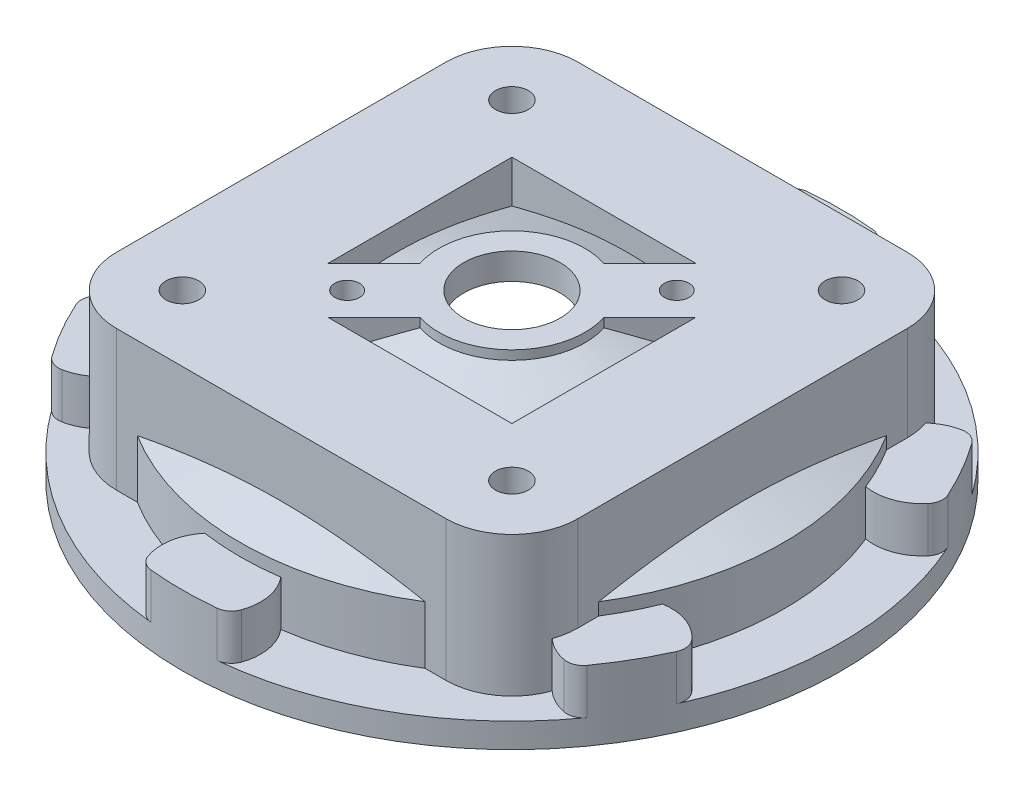
from build123d import *
from build123d.topology import SkipClean

# Parameters (mm, degrees)
SKETCH1_R                 = 40
SKETCH1_R_2               = 30
BOSS_EXTRUDE1_DEPTH       = 3
SKETCH2_R                 = 33
SKETCH2_R_2               = 30
BOSS_EXTRUDE2_DEPTH       = 7
BOSS_EXTRUDE3_REACH       = 62
SKETCH4_R                 = 5.848303283
BOSS_EXTRUDE5_DEPTH       = 17
F_4_0MM_DOWEL_HOLE2_D     = 4
F_4_0MM_DOWEL_HOLE3_D     = 4
F_4_0MM_DOWEL_HOLE3_DEPTH = 6.5
F_4_0MM_DOWEL_HOLE3_TIP   = 1.201721238
F_3_0MM_DOWEL_HOLE2_D     = 3
F_3_0MM_DOWEL_HOLE2_DEPTH = 4.2
F_3_0MM_DOWEL_HOLE2_TIP   = 0.901290929
SKETCH22_R                = 2
BOSS_EXTRUDE7_DEPTH       = 3.5
BOSS_EXTRUDE8_DEPTH       = 2
FILLET1_R                 = 2


with BuildPart() as part:
    # Sketch1 → Boss-Extrude1 (new body)
    with BuildSketch(Plane(origin=(0, 0, 0), x_dir=(1, 0, 0), z_dir=(0, 1, 0))):
        with Locations(Location((0, 0, 0), (0, 0, 270))):
            Circle(SKETCH1_R)
        with Locations(Location((0, 0, 0), (0, 0, 270))):
            Circle(SKETCH1_R_2, mode=Mode.SUBTRACT)
    extrude(amount=BOSS_EXTRUDE1_DEPTH)

    # Sketch2 → Boss-Extrude2 (add)
    with BuildSketch(Plane(origin=(0, 3, 0), x_dir=(1, 0, 0), z_dir=(0, 1, 0))):
        with Locations(Location((0, 0, 0), (0, 0, 270))):
            Circle(SKETCH2_R)
        with Locations(Location((0, 0, 0), (0, 0, 270))):
            Circle(SKETCH2_R_2, mode=Mode.SUBTRACT)
    extrude(amount=BOSS_EXTRUDE2_DEPTH)

    # Sketch3 → Revolve1 (revolve)
    with BuildSketch(Plane.XY, mode=Mode.PRIVATE) as revolve1_sk:
        Polygon((-33, 10), (-5.848303283, 20), (-5.848303283, 16.802999631), (-31.963181234, 7.184861132), align=None)
    revolve(revolve1_sk.sketch.rotate(Axis((0, 0, 0), (0, 1, 0)), 270), axis=Axis((0, 0, 0), (0, 1, 0)))

    # Boss-Extrude3: up to this cone (the profile starts outside it)
    boss_extrude3_end = Plane(origin=(0, 20, 0), z_dir=(0, -1, 0)).offset(-2.153935582) * Cone(2.715e-06, 191.425543469, 70.502238865, align=(Align.CENTER, Align.CENTER, Align.MIN), mode=Mode.PRIVATE)
    # Sketch4 → Boss-Extrude3 (add, up to the surface)
    with BuildSketch(Plane(origin=(0, 20, 0), x_dir=(1, 0, 0), z_dir=(0, 1, 0)), mode=Mode.PRIVATE) as boss_extrude3_sk1:
        with BuildLine():
            Line((-28, -20), (-28, 20))
            ThreePointArc((-28, 20), (-25.656854249, 25.656854249), (-20, 28))
            Line((-20, 28), (20, 28))
            ThreePointArc((20, 28), (25.656854249, 25.656854249), (28, 20))
            Line((28, 20), (28, -20))
            ThreePointArc((28, -20), (25.656854249, -25.656854249), (20, -28))
            Line((20, -28), (-20, -28))
            ThreePointArc((-20, -28), (-25.656854249, -25.656854249), (-28, -20))
        make_face()
        with Locations(Location((0, 0, 0), (0, 0, 90))):
            Circle(SKETCH4_R, mode=Mode.SUBTRACT)
        with BuildLine():
            Line((-14, -8.343145751), (-8.409308372, -2.752454122))
            ThreePointArc((-8.409308372, -2.752454122), (-6.256695253, 6.256695253), (2.752454122, 8.409308372))
            Line((2.752454122, 8.409308372), (8.343145751, 14))
            Line((8.343145751, 14), (-14, 14))
            Line((-14, 14), (-14, -8.343145751))
        make_face(mode=Mode.SUBTRACT)
        with BuildLine():
            Line((14, -14), (-8.343145751, -14))
            Line((-8.343145751, -14), (-2.752454122, -8.409308372))
            ThreePointArc((-2.752454122, -8.409308372), (6.256695253, -6.256695253), (8.409308372, 2.752454122))
            Line((8.409308372, 2.752454122), (14, 8.343145751))
            Line((14, 8.343145751), (14, -14))
        make_face(mode=Mode.SUBTRACT)
    boss_extrude3_tool1 = extrude(boss_extrude3_sk1.sketch, amount=-BOSS_EXTRUDE3_REACH, mode=Mode.PRIVATE) - boss_extrude3_end
    add(boss_extrude3_tool1.solids().sort_by_distance((-25.096854, 20, 25.096854))[0])

    # Sketch6 → Boss-Extrude5 (add)
    with BuildSketch(Plane(origin=(0, 20, 0), x_dir=(1, 0, 0), z_dir=(0, 1, 0))):
        with BuildLine():
            Line((-20, -28), (-17.464249197, -28))
            ThreePointArc((-17.464249197, -28), (-23.334523779, -23.334523779), (-28, -17.464249197))
            Line((-28, -17.464249197), (-28, -20))
            ThreePointArc((-28, -20), (-25.656854249, -25.656854249), (-20, -28))
        make_face()
        with BuildLine():
            Line((28, -20), (28, -17.464249197))
            ThreePointArc((28, -17.464249197), (23.334523779, -23.334523779), (17.464249197, -28))
            Line((17.464249197, -28), (20, -28))
            ThreePointArc((20, -28), (25.656854249, -25.656854249), (28, -20))
        make_face()
        with BuildLine():
            Line((20, 28), (17.464249197, 28))
            ThreePointArc((17.464249197, 28), (23.334523779, 23.334523779), (28, 17.464249197))
            Line((28, 17.464249197), (28, 20))
            ThreePointArc((28, 20), (25.656854249, 25.656854249), (20, 28))
        make_face()
        with BuildLine():
            Line((-28, 20), (-28, 17.464249197))
            ThreePointArc((-28, 17.464249197), (-23.334523779, 23.334523779), (-17.464249197, 28))
            Line((-17.464249197, 28), (-20, 28))
            ThreePointArc((-20, 28), (-25.656854249, 25.656854249), (-28, 20))
        make_face()
    extrude(amount=-BOSS_EXTRUDE5_DEPTH)

    # Ø4.0mm Dowel Hole2 (through all)
    with Locations(Plane(origin=(0, 3, 0), x_dir=(1, 0, 0), z_dir=(0, 1, 0))):
        with Locations((0, 36.5), (31.609927238, 18.25), (31.609927238, -18.25), (0, -36.5), (-31.609927238, -18.25), (-31.609927238, 18.25)):
            Hole(F_4_0MM_DOWEL_HOLE2_D / 2)

    # Ø4.0mm Dowel Hole3
    with Locations(Plane(origin=(0, 20, 0), x_dir=(1, 0, 0), z_dir=(0, 1, 0))):
        with Locations((-20, 20), (20, 20), (20, -20), (-20, -20)):
            Hole(F_4_0MM_DOWEL_HOLE3_D / 2, depth=F_4_0MM_DOWEL_HOLE3_DEPTH)
            with Locations((0, 0, -(F_4_0MM_DOWEL_HOLE3_DEPTH + F_4_0MM_DOWEL_HOLE3_TIP / 2))):  # 118° drill point
                Cone(0, F_4_0MM_DOWEL_HOLE3_D / 2, F_4_0MM_DOWEL_HOLE3_TIP, mode=Mode.SUBTRACT)

    # Ø3.0mm Dowel Hole2
    with Locations(Plane(origin=(0, 20, 0), x_dir=(1, 0, 0), z_dir=(0, 1, 0))):
        with Locations((10, 10), (-10, -10)):
            Hole(F_3_0MM_DOWEL_HOLE2_D / 2, depth=F_3_0MM_DOWEL_HOLE2_DEPTH)
            with Locations((0, 0, -(F_3_0MM_DOWEL_HOLE2_DEPTH + F_3_0MM_DOWEL_HOLE2_TIP / 2))):  # 118° drill point
                Cone(0, F_3_0MM_DOWEL_HOLE2_D / 2, F_3_0MM_DOWEL_HOLE2_TIP, mode=Mode.SUBTRACT)

    # Sketch22 → Boss-Extrude7 (add)
    # profile 1 of 6: a face of its own
    with SkipClean():  # the faces are left unmerged after this step: merging them gives an invalid solid
        with BuildSketch(Plane(origin=(0, 3, 0), x_dir=(1, 0, 0), z_dir=(0, 1, 0))):
            with BuildLine():
                ThreePointArc((-36.904921812, -15.428115441), (-34.641016151, -20), (-31.81360081, -24.246542093))
                ThreePointArc((-31.81360081, -24.246542093), (-28.269344004, -23.234024845), (-25.985874114, -20.340460824))
                ThreePointArc((-25.985874114, -20.340460824), (-28.578838325, -16.5), (-30.608292855, -12.33419671))
                ThreePointArc((-30.608292855, -12.33419671), (-34.25592775, -12.864957633), (-36.904921812, -15.428115441))
            make_face()
            with Locations(Location((-31.609927238, -18.25, 0), (0, 0, 270))):
                Circle(SKETCH22_R, mode=Mode.SUBTRACT)
        # profile 2 of 6: a face of its own
        with BuildSketch(Plane(origin=(0, 3, 0), x_dir=(1, 0, 0), z_dir=(0, 1, 0))):
            with BuildLine():
                ThreePointArc((36.904921812, 15.428115441), (34.641016151, 20), (31.81360081, 24.246542093))
                ThreePointArc((31.81360081, 24.246542093), (28.269344004, 23.234024845), (25.985874114, 20.340460824))
                ThreePointArc((25.985874114, 20.340460824), (28.578838325, 16.5), (30.608292855, 12.33419671))
                ThreePointArc((30.608292855, 12.33419671), (34.25592775, 12.864957633), (36.904921812, 15.428115441))
            make_face()
            with Locations(Location((31.609927238, 18.25, 0), (0, 0, 270))):
                Circle(SKETCH22_R, mode=Mode.SUBTRACT)
        # profile 3 of 6: a face of its own
        with BuildSketch(Plane(origin=(0, 3, 0), x_dir=(1, 0, 0), z_dir=(0, 1, 0))):
            with BuildLine():
                ThreePointArc((25.985874114, -20.340460824), (28.578838325, -16.5), (30.608292855, -12.33419671))
                ThreePointArc((30.608292855, -12.33419671), (34.25592775, -12.864957633), (36.904921812, -15.428115441))
                ThreePointArc((36.904921812, -15.428115441), (34.641016151, -20), (31.81360081, -24.246542093))
                ThreePointArc((31.81360081, -24.246542093), (28.269344004, -23.234024845), (25.985874114, -20.340460824))
            make_face()
            with Locations(Location((31.609927238, -18.25, 0), (0, 0, 270))):
                Circle(SKETCH22_R, mode=Mode.SUBTRACT)
        # profile 4 of 6: a face of its own
        with BuildSketch(Plane(origin=(0, 3, 0), x_dir=(1, 0, 0), z_dir=(0, 1, 0))):
            with BuildLine():
                ThreePointArc((-4.622418741, -32.674657534), (0, -33), (4.622418741, -32.674657534))
                ThreePointArc((4.622418741, -32.674657534), (5.986583746, -36.098982479), (5.091321001, -39.674657534))
                ThreePointArc((5.091321001, -39.674657534), (0, -40), (-5.091321001, -39.674657534))
                ThreePointArc((-5.091321001, -39.674657534), (-5.986583746, -36.098982479), (-4.622418741, -32.674657534))
            make_face()
            with Locations(Location((0, -36.5, 0), (0, 0, 270))):
                Circle(SKETCH22_R, mode=Mode.SUBTRACT)
        # profile 5 of 6: a face of its own
        with BuildSketch(Plane(origin=(0, 3, 0), x_dir=(1, 0, 0), z_dir=(0, 1, 0))):
            with BuildLine():
                ThreePointArc((-36.904921812, 15.428115441), (-34.25592775, 12.864957633), (-30.608292855, 12.33419671))
                ThreePointArc((-30.608292855, 12.33419671), (-28.578838325, 16.5), (-25.985874114, 20.340460824))
                ThreePointArc((-25.985874114, 20.340460824), (-28.269344004, 23.234024845), (-31.81360081, 24.246542093))
                ThreePointArc((-31.81360081, 24.246542093), (-34.641016151, 20), (-36.904921812, 15.428115441))
            make_face()
            with Locations(Location((-31.609927238, 18.25, 0), (0, 0, 270))):
                Circle(SKETCH22_R, mode=Mode.SUBTRACT)
        # profile 6 of 6: a face of its own
        with BuildSketch(Plane(origin=(0, 3, 0), x_dir=(1, 0, 0), z_dir=(0, 1, 0))):
            with BuildLine():
                ThreePointArc((4.622418741, 32.674657534), (5.986583746, 36.098982479), (5.091321001, 39.674657534))
                ThreePointArc((5.091321001, 39.674657534), (0, 40), (-5.091321001, 39.674657534))
                ThreePointArc((-5.091321001, 39.674657534), (-5.986583746, 36.098982479), (-4.622418741, 32.674657534))
                ThreePointArc((-4.622418741, 32.674657534), (0, 33), (4.622418741, 32.674657534))
            make_face()
            with Locations(Location((0, 36.5, 0), (0, 0, 270))):
                Circle(SKETCH22_R, mode=Mode.SUBTRACT)
        extrude(amount=BOSS_EXTRUDE7_DEPTH)

    # Sketch23 → Boss-Extrude8 (add)
    with SkipClean():  # the faces are left unmerged after this step: merging them gives an invalid solid
        with BuildSketch(Plane(origin=(0, 6.5, 0), x_dir=(1, 0, 0), z_dir=(0, 1, 0))):
            with BuildLine():
                Line((-28, -20), (-28, -17.464249197))
                ThreePointArc((-28, -17.464249197), (-29.416192097, -14.956190776), (-30.608292855, -12.33419671))
                ThreePointArc((-30.608292855, -12.33419671), (-34.25592775, -12.864957633), (-36.904921812, -15.428115441))
                ThreePointArc((-36.904921812, -15.428115441), (-34.641016151, -20), (-31.81360081, -24.246542093))
                ThreePointArc((-31.81360081, -24.246542093), (-29.52266146, -23.87523969), (-27.544015834, -22.662296959))
                ThreePointArc((-27.544015834, -22.662296959), (-27.885179981, -21.350531993), (-28, -20))
            make_face()
            with BuildLine():
                Line((28, -17.464249197), (28, -20))
                ThreePointArc((28, -20), (27.885179981, -21.350531993), (27.544015834, -22.662296959))
                ThreePointArc((27.544015834, -22.662296959), (29.52266146, -23.87523969), (31.81360081, -24.246542093))
                ThreePointArc((31.81360081, -24.246542093), (34.641016151, -20), (36.904921812, -15.428115441))
                ThreePointArc((36.904921812, -15.428115441), (34.25592775, -12.864957633), (30.608292855, -12.33419671))
                ThreePointArc((30.608292855, -12.33419671), (29.416192097, -14.956190776), (28, -17.464249197))
            make_face()
            with BuildLine():
                Line((28, 20), (28, 17.464249197))
                ThreePointArc((28, 17.464249197), (29.416192097, 14.956190776), (30.608292855, 12.33419671))
                ThreePointArc((30.608292855, 12.33419671), (34.25592775, 12.864957633), (36.904921812, 15.428115441))
                ThreePointArc((36.904921812, 15.428115441), (34.641016151, 20), (31.81360081, 24.246542093))
                ThreePointArc((31.81360081, 24.246542093), (29.52266146, 23.87523969), (27.544015834, 22.662296959))
                ThreePointArc((27.544015834, 22.662296959), (27.885179981, 21.350531993), (28, 20))
            make_face()
            with BuildLine():
                Line((-28, 17.464249197), (-28, 20))
                ThreePointArc((-28, 20), (-27.885179981, 21.350531993), (-27.544015834, 22.662296959))
                ThreePointArc((-27.544015834, 22.662296959), (-29.52266146, 23.87523969), (-31.81360081, 24.246542093))
                ThreePointArc((-31.81360081, 24.246542093), (-34.641016151, 20), (-36.904921812, 15.428115441))
                ThreePointArc((-36.904921812, 15.428115441), (-34.25592775, 12.864957633), (-30.608292855, 12.33419671))
                ThreePointArc((-30.608292855, 12.33419671), (-29.416192097, 14.956190776), (-28, 17.464249197))
            make_face()
            with BuildLine():
                ThreePointArc((5.091321001, -39.674657534), (5.986583746, -36.098982479), (4.622418741, -32.674657534))
                ThreePointArc((4.622418741, -32.674657534), (0, -33), (-4.622418741, -32.674657534))
                ThreePointArc((-4.622418741, -32.674657534), (-5.986583746, -36.098982479), (-5.091321001, -39.674657534))
                ThreePointArc((-5.091321001, -39.674657534), (0, -40), (5.091321001, -39.674657534))
            make_face()
            with BuildLine():
                ThreePointArc((-5.091321001, 39.674657534), (-5.986583746, 36.098982479), (-4.622418741, 32.674657534))
                ThreePointArc((-4.622418741, 32.674657534), (0, 33), (4.622418741, 32.674657534))
                ThreePointArc((4.622418741, 32.674657534), (5.986583746, 36.098982479), (5.091321001, 39.674657534))
                ThreePointArc((5.091321001, 39.674657534), (0, 40), (-5.091321001, 39.674657534))
            make_face()
        extrude(amount=BOSS_EXTRUDE8_DEPTH)

    # Fillet1
    # the kernel refuses this fillet: 2 mm, written as the material it takes off along each edge
    with BuildSketch(Plane(origin=(-31.81360081, 3, -24.246542093), x_dir=(-0.5949610742937156, 0, 0.8037545148086372), z_dir=(0, 1, 0)), Plane(origin=(36.904921812, 3, -15.428115441), x_dir=(-0.39859129108386376, 0, -0.9171286620055544), z_dir=(0, 1, 0)), Plane(origin=(31.81360081, 3, 24.246542093), x_dir=(0.5949610742937145, 0, -0.803754514808638), z_dir=(0, 1, 0)), Plane(origin=(-5.091321001, 3, 39.674657534), x_dir=(0.9935523653775744, 0, 0.11337414719691218), z_dir=(0, 1, 0)), Plane(origin=(-36.904921812, 3, 15.428115441), x_dir=(0.3985912910838727, 0, 0.9171286620055507), z_dir=(0, 1, 0)), Plane(origin=(5.091321001, 3, -39.674657534), x_dir=(-0.9935523653775736, 0, -0.11337414719691864), z_dir=(0, 1, 0))) as fillet1_piece_1:
        with BuildLine():
            CenterArc((1.092806443, 1.999803701), FILLET1_R, 205.651885375, 65.150874184)
            ThreePointArc((-0.710075302, 1.133999212), (-0.386746003, 0.547144815), (0, 0))
            ThreePointArc((0, 0), (0.560413561, -0.003925985), (1.120827121, 0))
        make_face()
    extrude(amount=3.5, mode=Mode.SUBTRACT)
    with BuildSketch(Plane(origin=(-36.904921812, 3, -15.428115441), x_dir=(0.3985912910838608, 0, -0.9171286620055557), z_dir=(0, 1, 0)), Plane(origin=(31.81360081, 3, -24.246542093), x_dir=(0.5949610742937109, 0, 0.8037545148086406), z_dir=(0, 1, 0)), Plane(origin=(36.904921812, 3, 15.428115441), x_dir=(-0.39859129108386665, 0, 0.9171286620055532), z_dir=(0, 1, 0)), Plane(origin=(5.091321001, 3, 39.674657534), x_dir=(-0.9935523653775744, 0, 0.113374147196912), z_dir=(0, 1, 0)), Plane(origin=(-31.81360081, 3, 24.246542093), x_dir=(-0.594961074293712, 0, -0.8037545148086399), z_dir=(0, 1, 0)), Plane(origin=(-5.091321001, 3, -39.674657534), x_dir=(0.9935523653775744, 0, -0.11337414719691113), z_dir=(0, 1, 0))) as fillet1_piece_2:
        with BuildLine():
            CenterArc((1.092806443, -1.999803701), FILLET1_R, 89.197240441, 65.150874184)
            ThreePointArc((-0.710075302, -1.133999212), (-0.386746003, -0.547144815), (0, 0))
            ThreePointArc((0, 0), (0.560413561, 0.003925985), (1.120827121, 0))
        make_face()
    extrude(amount=3.5, mode=Mode.SUBTRACT)
    with BuildSketch(Plane(origin=(5.091321001, 6.5, -39.674657534), x_dir=(-0.9935523653775731, 0, -0.11337414719692375), z_dir=(0, 1, 0)), Plane(origin=(-36.904921812, 6.5, 15.428115441), x_dir=(0.3985912910838673, 0, 0.9171286620055529), z_dir=(0, 1, 0)), Plane(origin=(-5.091321001, 6.5, 39.674657534), x_dir=(0.9935523653775744, 0, 0.1133741471969115), z_dir=(0, 1, 0)), Plane(origin=(31.81360081, 6.5, 24.246542093), x_dir=(0.5949610742937155, 0, -0.8037545148086372), z_dir=(0, 1, 0)), Plane(origin=(36.904921812, 6.5, -15.428115441), x_dir=(-0.3985912910838673, 0, -0.9171286620055529), z_dir=(0, 1, 0)), Plane(origin=(-31.81360081, 6.5, -24.246542093), x_dir=(-0.594961074293713, 0, 0.8037545148086391), z_dir=(0, 1, 0))) as fillet1_piece_3:
        with BuildLine():
            CenterArc((1.092806443, 1.999803701), FILLET1_R, 205.651885375, 65.150874184)
            ThreePointArc((-0.710075302, 1.133999212), (-0.386746003, 0.547144815), (0, 0))
            ThreePointArc((0, 0), (0.560413561, -0.003925985), (1.120827121, 0))
        make_face()
    extrude(amount=5.344922595, mode=Mode.SUBTRACT)
    with BuildSketch(Plane(origin=(-5.091321001, 6.5, -39.674657534), x_dir=(0.9935523653775736, 0, -0.11337414719691792), z_dir=(0, 1, 0)), Plane(origin=(-31.81360081, 6.5, 24.246542093), x_dir=(-0.5949610742937074, 0, -0.8037545148086432), z_dir=(0, 1, 0)), Plane(origin=(5.091321001, 6.5, 39.674657534), x_dir=(-0.9935523653775744, 0, 0.11337414719691105), z_dir=(0, 1, 0)), Plane(origin=(36.904921812, 6.5, 15.428115441), x_dir=(-0.39859129108386426, 0, 0.9171286620055541), z_dir=(0, 1, 0)), Plane(origin=(31.81360081, 6.5, -24.246542093), x_dir=(0.5949610742937089, 0, 0.8037545148086421), z_dir=(0, 1, 0)), Plane(origin=(-36.904921812, 6.5, -15.428115441), x_dir=(0.3985912910838685, 0, -0.9171286620055524), z_dir=(0, 1, 0))) as fillet1_piece_4:
        with BuildLine():
            CenterArc((1.092806443, -1.999803701), FILLET1_R, 89.197240441, 65.150874184)
            ThreePointArc((-0.710075302, -1.133999212), (-0.386746003, -0.547144815), (0, 0))
            ThreePointArc((0, 0), (0.560413561, 0.003925985), (1.120827121, 0))
        make_face()
    extrude(amount=5.344922595, mode=Mode.SUBTRACT)


solid = part.part
